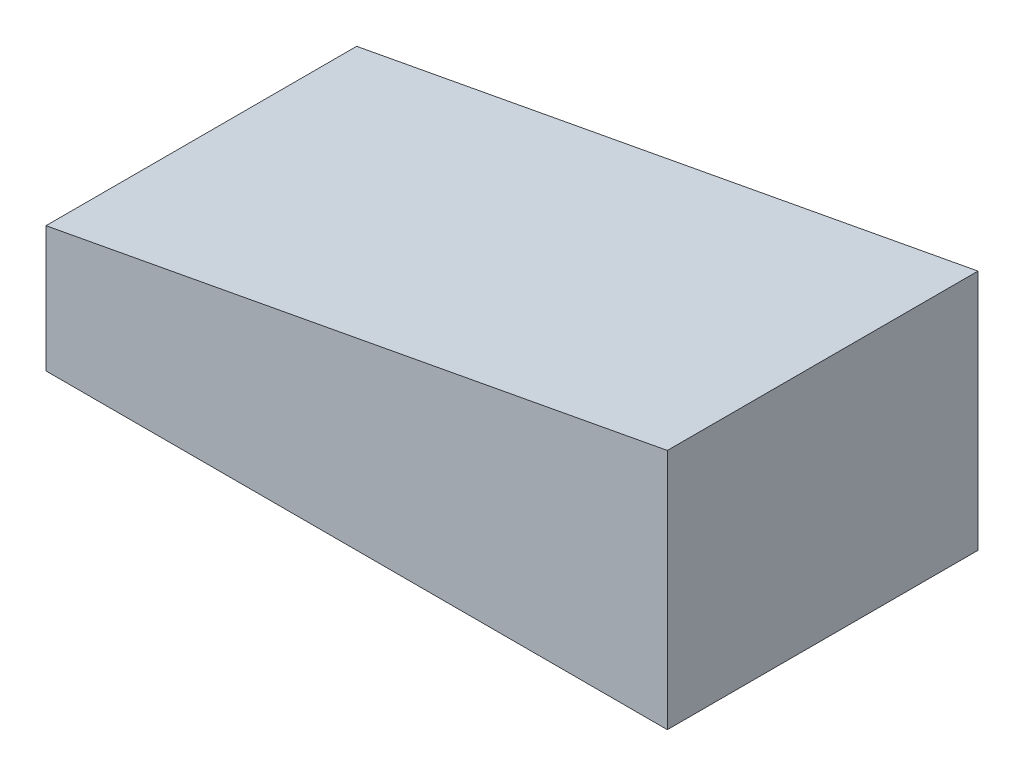
from build123d import *

# Parameters (mm, degrees)
MAINBASESKETCH_W          = 15.8
MAINBASESKETCH_H          = 3.2
MAINBASEEXTRUDE_DEPTH     = 7.9
STUDSSKETCH_R             = 2.4
STUDSEXTRUDE_DEPTH        = 1.6
MAINBASESHELL_T           = -1.2
LCUTBLUE_DEPTH            = 19.555463972
LCUTBLUE_DEPTH_BACK       = 19.555463972
CUTADDEDTOLCUT_DEPTH      = 2
MADESLIMCUTSKETCH_W       = 7.9
MADESLIMCUTSKETCH_H       = 7.9
MADESLIMCUT_DEPTH         = 19.897228453
MADESLIMFILLEXT_REACH     = 20.555
SKETCH33_W                = 5.500952983
SKETCH33_H                = 1.199047018
SLIMHOLEEXT_START         = -0.2
SLIMHOLESKETCH_R          = 1.25
SLIMHOLESKETCH_R_2        = 0.75
SLIMHOLEEXT_DEPTH         = 2
ANGLEDSLIMBASECUT_DEPTH   = 19.555463972
ANGLEDSLIMBASESWEEP_DEPTH = 7.9


# Read off the part's stored shape, not the designer's step: AngledSlimBaseSweep
with BuildPart() as part:
    # MainBaseSketch → MainBaseExtrude (new, symmetric)
    with BuildSketch(Plane.XY):
        with Locations((8.581967213, 1.6)):
            Rectangle(MAINBASESKETCH_W, MAINBASESKETCH_H)
    extrude(amount=MAINBASEEXTRUDE_DEPTH, both=True)

    # StudsSketch → StudsExtrude (add)
    with BuildSketch(Plane(origin=(0, 3.2, 0), x_dir=(1, 0, 0), z_dir=(0, 1, 0))):
        with Locations((4.581967213, 4)):
            Circle(STUDSSKETCH_R)
    extrude(amount=STUDSEXTRUDE_DEPTH)

    # MainBaseShell
    mainbaseshell_openings = [part.faces().sort_by_distance(p)[0] for p in [
        (8.581967213, 0, 0),
    ]]
    offset(amount=MAINBASESHELL_T, openings=mainbaseshell_openings, kind=Kind.INTERSECTION)

    # LCUTBlueSketch → LCutBlue (cut, two sides: drawn at the far end of the back side and taken through both)
    with BuildSketch(Plane(origin=(0, 3.2, 0), x_dir=(1, 0, 0), z_dir=(0, 1, 0)).offset(-LCUTBLUE_DEPTH_BACK)):
        Polygon((8.581967213, 53.229874044), (8.581967213, 7.9), (8.581967213, 0), (16.481967213, 0), (61.811841258, 0), (125.917963912, 64.106122654), (72.688089868, 117.335996699), align=None)
    extrude(amount=LCUTBLUE_DEPTH + LCUTBLUE_DEPTH_BACK, mode=Mode.SUBTRACT)

    # CutAddedtoLSketch → CutAddedToLCut (add)
    with BuildSketch(Plane.XZ):
        Polygon((7.382920196, -6.7), (8.581967213, -6.7), (8.581967213, 0), (15.281967213, 0), (15.281967213, 1.199047018), (7.382920196, 1.199047018), (7.382920196, 0), align=None)
    extrude(amount=-CUTADDEDTOLCUT_DEPTH)

    # MadeSlimCutSketch → MadeSlimCut (cut, through all)
    with BuildSketch(Plane.XZ):
        with Locations((4.631967213, -3.95)):
            Rectangle(MADESLIMCUTSKETCH_W, MADESLIMCUTSKETCH_H)
    extrude(amount=-MADESLIMCUT_DEPTH, mode=Mode.SUBTRACT)

    # Sketch33 → MadeSlimFillExt (add, up to next)
    with BuildSketch(Plane.XZ, mode=Mode.PRIVATE) as madeslimfillext_sk1:
        with Locations((4.632443704, 0.599523509)):
            Rectangle(SKETCH33_W, SKETCH33_H)
    madeslimfillext_tool1 = extrude(madeslimfillext_sk1.sketch, amount=-MADESLIMFILLEXT_REACH, mode=Mode.PRIVATE) - part.part
    add(madeslimfillext_tool1.solids().sort_by_distance((4.632444, 0, 0.599524))[0])

    # SlimHoleSketch → SlimHoleExt (add)
    with BuildSketch(Plane.XZ.offset(-2).offset(SLIMHOLEEXT_START)):
        with Locations((8.581967213, 4)):
            Circle(SLIMHOLESKETCH_R)
        with Locations((8.581967213, 4)):
            Circle(SLIMHOLESKETCH_R_2, mode=Mode.SUBTRACT)
    extrude(amount=SLIMHOLEEXT_DEPTH)

    # AngledSlimBaseSketch → AngledSlimBaseCut (cut, through all)
    with BuildSketch(Plane.XY.offset(7.9)):
        Polygon((0.681967213, 2.247699421), (16.481967213, 2.247699421), (16.481967213, 6.15), (0.681967213, 3.2), align=None)
    extrude(amount=-ANGLEDSLIMBASECUT_DEPTH, mode=Mode.SUBTRACT)

    # AngledSlimBaseSweep outline → AngledSlimBaseSweep (add)
    with BuildSketch(Plane.XY):
        Polygon((16.481967213, 2.247699421), (16.481967213, 6.15), (0.681967213, 3.2), (0.681967213, 2.247699421), align=None)
    extrude(amount=ANGLEDSLIMBASESWEEP_DEPTH)


solid = part.part
